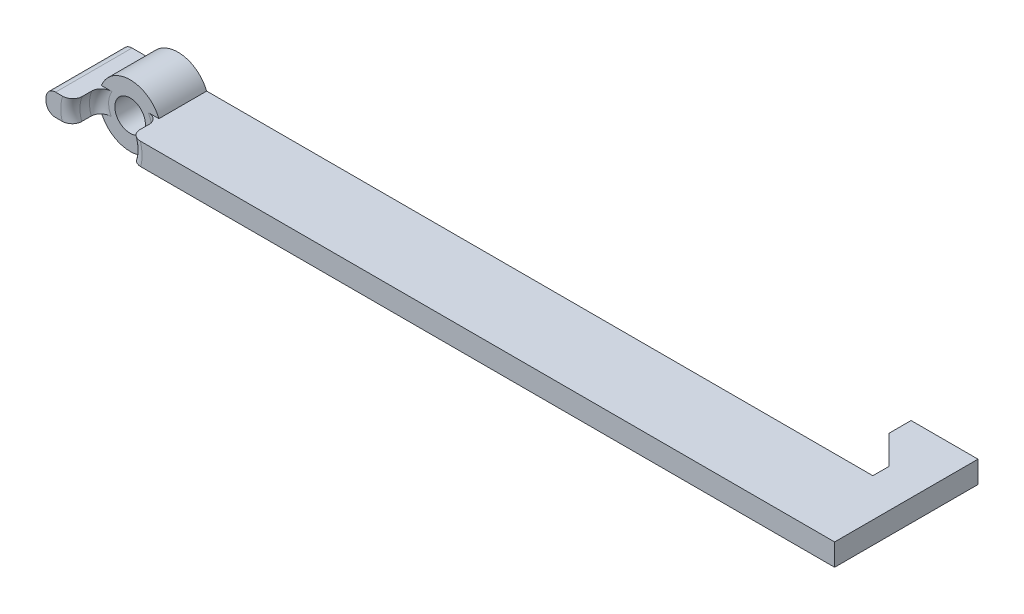
from build123d import *

# Parameters (mm, degrees)
BOSS_EXTRUDE1_DEPTH = 2.3
SKETCH2_R           = 3.25
BOSS_EXTRUDE2_DEPTH = 8
SKETCH3_R           = 1.6
CUT_EXTRUDE1_DEPTH  = 8
CUT_EXTRUDE2_START  = -3
SKETCH4_R           = 3.25
CUT_EXTRUDE2_DEPTH  = 3
FILLET1_R           = 1
SKETCH5_W           = 5.3
SKETCH5_H           = 2.3
BOSS_EXTRUDE3_DEPTH = 3
CHAMFER1_SIZE       = 3


# Some blends are built 0.0001 mm under size
with BuildPart() as part:
    # Sketch1 → Boss-Extrude1 (new body)
    with BuildSketch(Plane(origin=(0, 0, 0), x_dir=(1, 0, 0), z_dir=(0, 1, 0))):
        Polygon((-78.5, 0), (0, 0), (0, 7), (4, 7), (4, -8), (-78.5, -8), align=None)
    extrude(amount=BOSS_EXTRUDE1_DEPTH)

    # Sketch2 → Boss-Extrude2 (add)
    with BuildSketch(Plane(origin=(0, 0, 0), x_dir=(-1, 0, 0), z_dir=(0, 0, -1))):
        with Locations((72.7, 1.076790216)):
            Circle(SKETCH2_R)
    extrude(amount=-BOSS_EXTRUDE2_DEPTH)

    # Sketch3 → Cut-Extrude1 (cut)
    with BuildSketch(Plane(origin=(0, 0, 0), x_dir=(-1, 0, 0), z_dir=(0, 0, -1))):
        with Locations((72.7, 1.076790216)):
            Circle(SKETCH3_R)
    extrude(amount=-CUT_EXTRUDE1_DEPTH, mode=Mode.SUBTRACT)

    # Sketch4 → Cut-Extrude2 (cut)
    with BuildSketch(Plane.XY.offset(8).offset(CUT_EXTRUDE2_START)):
        with Locations((-72.7, 1.076790216)):
            Circle(SKETCH4_R)
    extrude(amount=CUT_EXTRUDE2_DEPTH, mode=Mode.SUBTRACT)

    # Fillet1
    # the kernel refuses this fillet: 1 mm, written as the material it adds along each edge
    with BuildSketch(Plane(origin=(-72.7, 1.076790216, 5), x_dir=(-0.40375953104752016, 0.9148651491276113, 0), z_dir=(0.9148651491276113, 0.40375953104752016, 0))) as fillet1_piece_1_section:
        with BuildLine():
            CenterArc((3.25 - FILLET1_R, FILLET1_R), FILLET1_R, 270, 90)
            Line((3.25, FILLET1_R), (3.25, 0))
            Line((3.25, 0), (3.25 - FILLET1_R, 0))
        make_face()
    fillet1_piece_1 = revolve(axis=Axis((-72.7, 1.076790216, 5), (0, 0, 1)), revolution_arc=129.612934005, mode=Mode.PRIVATE)
    fillet1_piece_1 = split(fillet1_piece_1, bisect_by=Plane(origin=(-75.648358943, 2.3, 5.222958047), z_dir=(0, -1, 0)), keep=Keep.TOP, mode=Mode.PRIVATE)
    fillet1_piece_1 = split(fillet1_piece_1, bisect_by=Plane(origin=(-75.648358943, 0, 5.222958047), z_dir=(0, 1, 0)), keep=Keep.TOP, mode=Mode.PRIVATE)
    add(fillet1_piece_1)
    with BuildSketch(Plane(origin=(-72.7, 1.076790216, 5), x_dir=(0.44734781927350936, -0.8943600665231177, 0), z_dir=(-0.8943600665231177, -0.44734781927350936, 0))) as fillet1_piece_2_section:
        with BuildLine():
            CenterArc((3.25 - FILLET1_R, FILLET1_R), FILLET1_R, 270, 90)
            Line((3.25, FILLET1_R), (3.25, 0))
            Line((3.25, 0), (3.25 - FILLET1_R, 0))
        make_face()
    fillet1_piece_2 = revolve(axis=Axis((-72.7, 1.076790216, 5), (0, 0, 1)), revolution_arc=129.612934005, mode=Mode.PRIVATE)
    fillet1_piece_2 = split(fillet1_piece_2, bisect_by=Plane(origin=(-69.751641159, 2.3, 5.222958106), z_dir=(0, -1, 0)), keep=Keep.TOP, mode=Mode.PRIVATE)
    fillet1_piece_2 = split(fillet1_piece_2, bisect_by=Plane(origin=(-69.751641159, 0, 5.222958106), z_dir=(0, 1, 0)), keep=Keep.TOP, mode=Mode.PRIVATE)
    add(fillet1_piece_2)
    # the kernel refuses this fillet: 1 mm, written as the material it takes off along each edge
    with BuildSketch(Plane(origin=(-78.5, 2.3, 10.5), x_dir=(0, -1, 0), z_dir=(0, 0, -1)), Plane(origin=(-78.5, 0, 10.5), x_dir=(1, 0, 0), z_dir=(0, 0, -1))) as fillet1_2_piece_1:
        with BuildLine():
            CenterArc((FILLET1_R, -FILLET1_R), FILLET1_R, 90, 90)
            Line((0, -FILLET1_R), (0, 0))
            Line((0, 0), (FILLET1_R, 0))
        make_face()
    extrude(amount=13, mode=Mode.SUBTRACT)
    with BuildSketch(Plane(origin=(-72.7, 1.076790216, 8), x_dir=(-0.40375953104750745, 0.914865149127617, 0), z_dir=(0.914865149127617, 0.40375953104750745, 0))) as fillet1_2_piece_2:
        with BuildLine():
            CenterArc((3.25 + FILLET1_R, -FILLET1_R), FILLET1_R, 90, 90)
            Line((3.25, -FILLET1_R), (3.25, 0))
            Line((3.25, 0), (3.25 + FILLET1_R, 0))
        make_face()
    revolve(axis=Axis((-72.7, 1.076790216, 8), (0, 0, 1)), revolution_arc=129.612934005, mode=Mode.SUBTRACT)
    with BuildSketch(Plane(origin=(-72.7, 1.076790216, 8), x_dir=(0.44734781927345224, -0.8943600665231464, 7.1054273576009774e-15), z_dir=(-0.8943600665231464, -0.44734781927345224, 3.689898674328445e-15))) as fillet1_2_piece_3:
        with BuildLine():
            CenterArc((3.25 + FILLET1_R, -FILLET1_R), FILLET1_R, 90, 90)
            Line((3.25 + FILLET1_R, 0), (3.25, 0))
            Line((3.25, 0), (3.25, -FILLET1_R))
        make_face()
    revolve(axis=Axis((-72.7, 1.076790216, 8), (0, 0, 1)), revolution_arc=129.612934005, mode=Mode.SUBTRACT)

    # Sketch5 → Boss-Extrude3 (add)
    with BuildSketch(Plane.ZY):
        with Locations((-4.35, 1.15)):
            Rectangle(SKETCH5_W, SKETCH5_H)
    extrude(amount=BOSS_EXTRUDE3_DEPTH)

    # Chamfer1
    chamfer1_edges = [part.edges().sort_by_distance(p)[0] for p in [
        (-3, 1.15, -1.7),
    ]]
    chamfer(chamfer1_edges, length=CHAMFER1_SIZE - 0.0001)  # a hair under: the kernel refuses the full size


solid = part.part
